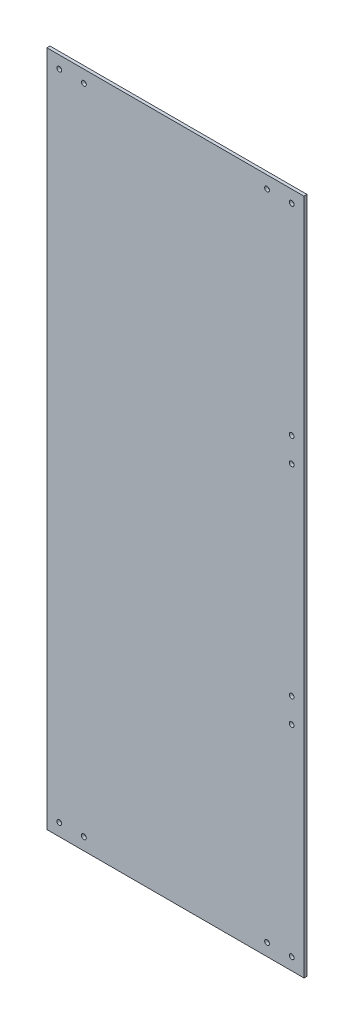
from build123d import *

# Parameters (mm, degrees)
SKETCH1_W                  = 698.5
SKETCH1_H                  = 265.176
BOSS_EXTRUDE1_DEPTH        = 3.175
F_9_0_196_DIAMETER_HOLE2_D = 4.9784


with BuildPart() as part:
    # Sketch1 → Boss-Extrude1 (new body)
    with BuildSketch(Plane(origin=(0, 0, 0), x_dir=(0, 1, 0), z_dir=(0, 0, 1))):
        Rectangle(SKETCH1_W, SKETCH1_H)
    extrude(amount=BOSS_EXTRUDE1_DEPTH)

    # #9 (0.196) Diameter Hole2 (through all)
    with Locations(Plane.XY.offset(3.175)):
        with Locations((-119.888, 336.55), (-94.488, 336.55), (94.488, 336.55), (119.888, 336.55), (119.888, -336.55), (94.488, -336.55), (-94.488, -336.55), (-119.888, -336.55), (-371.836153613, -199.719855434), (119.888, 129.116666667), (119.888, 103.716666667), (119.888, -103.716666667), (119.888, -129.116666667)):
            Hole(F_9_0_196_DIAMETER_HOLE2_D / 2)


solid = part.part
